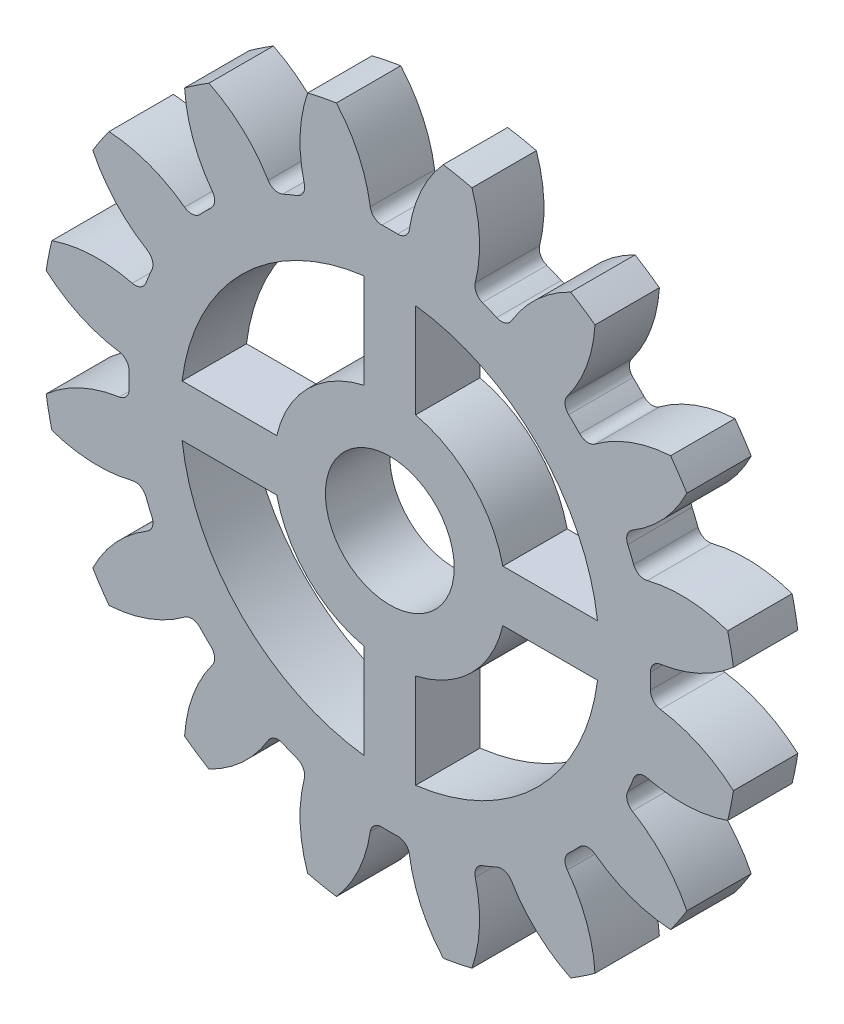
from build123d import *

# Parameters (mm, degrees)
SKETCH1_R                = 27
BOSS_EXTRUDE1_DEPTH      = 2.5
CUT_EXTRUDE1_DEPTH       = 39.265519727
FILLET1_R                = 0.9
CIRPATTERN1_COUNT        = 16
FILLET1_OF_CIRPATTERN1_R = 0.9
CUT_EXTRUDE2_DEPTH       = 39.060405994
CUT_EXTRUDE2_DEPTH_BACK  = 39.060405994
SKETCH3_R                = 5


with BuildPart() as part:
    # Sketch1 → Boss-Extrude1 (new, symmetric)
    with BuildSketch(Plane.XY):
        Circle(SKETCH1_R)
    extrude(amount=BOSS_EXTRUDE1_DEPTH, both=True)

    # Sketch2 → Cut-Extrude1 (cut, symmetric)
    with BuildSketch(Plane.XY):
        with BuildLine():
            ThreePointArc((-5.005455668, 27.548963929), (-2.508397883, 24.219474422), (-1.431751036, 20.199321498))
            ThreePointArc((-1.431751036, 20.199321498), (0, 20.25), (1.431751036, 20.199321498))
            ThreePointArc((1.431751036, 20.199321498), (2.508397883, 24.219474422), (5.005455668, 27.548963929))
            ThreePointArc((5.005455668, 27.548963929), (0, 28), (-5.005455668, 27.548963929))
        make_face()
    cut_extrude1 = extrude(amount=CUT_EXTRUDE1_DEPTH, both=True, mode=Mode.SUBTRACT)

    # Fillet1
    fillet1_edges = [part.edges().sort_by_distance(p)[0] for p in [
        (1.431751036, 20.199321498, 0),
        (-1.431751036, 20.199321498, 0),
    ]]
    fillet(fillet1_edges, radius=FILLET1_R)

    # CirPattern1: Cut-Extrude1 ×16 about axis
    cirpattern1_axis = Axis((0, 0, 2.5), (0, 0, 1))
    for i in range(1, CIRPATTERN1_COUNT):
        add(cut_extrude1.rotate(cirpattern1_axis, i * 360 / CIRPATTERN1_COUNT), mode=Mode.SUBTRACT)

    # Fillet1 of CirPattern1
    fillet1_of_cirpattern1_edges = [part.edges().sort_by_distance(p)[0] for p in [
        (-6.407180204, 19.209647103, 0),
        (-9.05271116, 18.113832302, 0),
        (-13.27067634, 15.295478073, 0),
        (-15.295478073, 13.27067634, 0),
        (-18.113832302, 9.05271116, 0),
        (-19.209647103, 6.407180204, 0),
        (-20.199321498, 1.431751036, 0),
        (-20.199321498, -1.431751036, 0),
        (-19.209647103, -6.407180204, 0),
        (-18.113832302, -9.05271116, 0),
        (-15.295478073, -13.27067634, 0),
        (-13.27067634, -15.295478073, 0),
        (-9.05271116, -18.113832302, 0),
        (-6.407180204, -19.209647103, 0),
        (-1.431751036, -20.199321498, 0),
        (1.431751036, -20.199321498, 0),
        (6.407180204, -19.209647103, 0),
        (9.05271116, -18.113832302, 0),
        (13.27067634, -15.295478073, 0),
        (15.295478073, -13.27067634, 0),
        (18.113832302, -9.05271116, 0),
        (19.209647103, -6.407180204, 0),
        (20.199321498, -1.431751036, 0),
        (20.199321498, 1.431751036, 0),
        (19.209647103, 6.407180204, 0),
        (18.113832302, 9.05271116, 0),
        (15.295478073, 13.27067634, 0),
        (13.27067634, 15.295478073, 0),
        (9.05271116, 18.113832302, 0),
        (6.407180204, 19.209647103, 0),
    ]]
    fillet(fillet1_of_cirpattern1_edges, radius=FILLET1_OF_CIRPATTERN1_R)

    # Sketch3 → Cut-Extrude2 (cut, two sides: drawn at the far end of the back side and taken through both)
    with BuildSketch(Plane.XY.offset(2.5).offset(-CUT_EXTRUDE2_DEPTH_BACK)):
        Circle(SKETCH3_R)
        with BuildLine():
            Line((-2, 16.126453423), (-2, 8.774964387))
            ThreePointArc((-2, 8.774964387), (-6.363961031, 6.363961031), (-8.774964387, 2))
            Line((-8.774964387, 2), (-16.126453423, 2))
            ThreePointArc((-16.126453423, 2), (-11.490485194, 11.490485194), (-2, 16.126453423))
        make_face()
        with BuildLine():
            Line((2, 16.126453423), (2, 8.774964387))
            ThreePointArc((2, 8.774964387), (6.363961031, 6.363961031), (8.774964387, 2))
            Line((8.774964387, 2), (16.126453423, 2))
            ThreePointArc((16.126453423, 2), (11.490485194, 11.490485194), (2, 16.126453423))
        make_face()
        with BuildLine():
            Line((16.126453423, -2), (8.774964387, -2))
            ThreePointArc((8.774964387, -2), (6.363961031, -6.363961031), (2, -8.774964387))
            Line((2, -8.774964387), (2, -16.126453423))
            ThreePointArc((2, -16.126453423), (11.490485194, -11.490485194), (16.126453423, -2))
        make_face()
        with BuildLine():
            Line((-2, -16.126453423), (-2, -8.774964387))
            ThreePointArc((-2, -8.774964387), (-6.363961031, -6.363961031), (-8.774964387, -2))
            Line((-8.774964387, -2), (-16.126453423, -2))
            ThreePointArc((-16.126453423, -2), (-11.490485194, -11.490485194), (-2, -16.126453423))
        make_face()
    extrude(amount=CUT_EXTRUDE2_DEPTH + CUT_EXTRUDE2_DEPTH_BACK, mode=Mode.SUBTRACT)


solid = part.part
